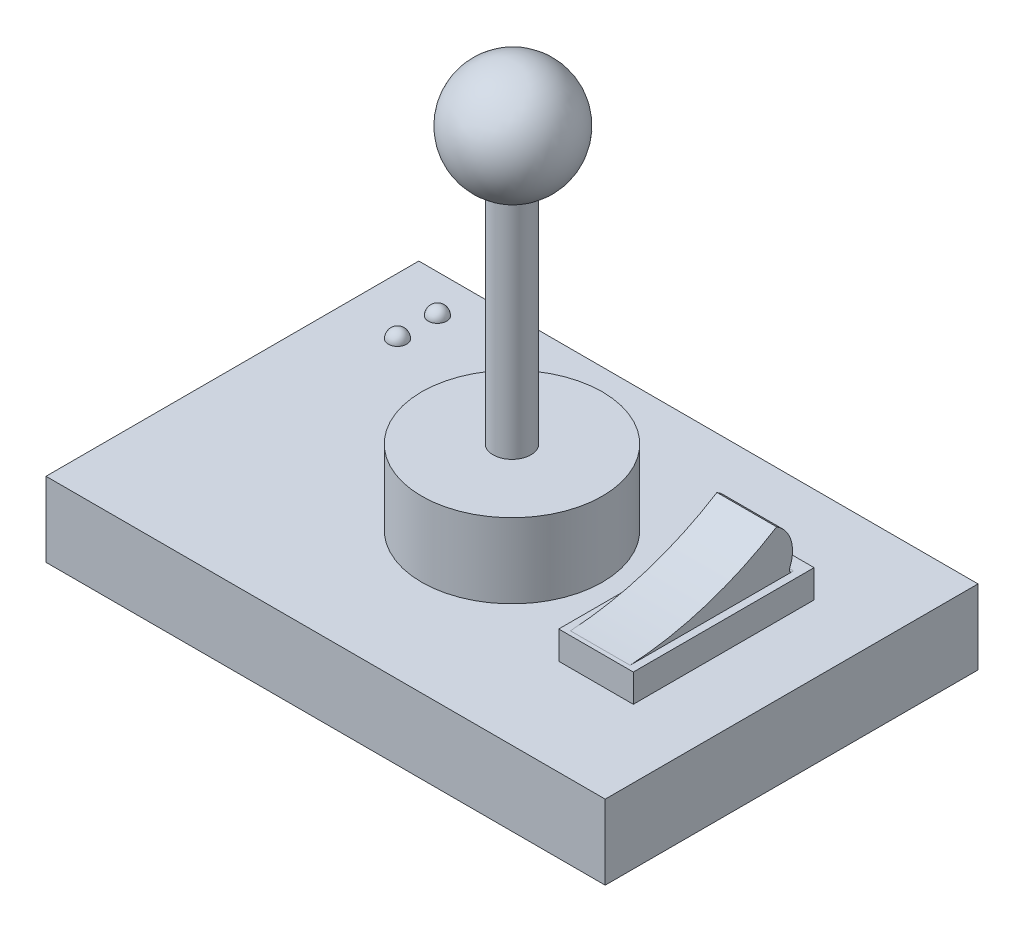
from build123d import *

# Parameters (mm, degrees)
SKETCH1_W            = 150
SKETCH1_H            = 100
BOSS_EXTRUDE1_DEPTH  = 20
SKETCH2_R            = 24.239154651
BOSS_EXTRUDE2_DEPTH  = 40
SKETCH3_R            = 5.073901121
BOSS_EXTRUDE3_DEPTH  = 100
SKETCH17_W           = 20
SKETCH17_H           = 48.5
BOSS_EXTRUDE14_DEPTH = 7.5
BOSS_EXTRUDE15_START = -2
BOSS_EXTRUDE15_DEPTH = 16
FILLET5_START        = 38.747344483
FILLET5_DEPTH        = 16


with BuildPart() as part:
    # Sketch1 → Boss-Extrude1 (new body)
    with BuildSketch(Plane(origin=(0, 0, 0), x_dir=(1, 0, 0), z_dir=(0, 1, 0))):
        Rectangle(SKETCH1_W, SKETCH1_H)
    extrude(amount=BOSS_EXTRUDE1_DEPTH)

    # Sketch2 → Boss-Extrude2 (add)
    with BuildSketch(Plane(origin=(0, 0, 0), x_dir=(1, 0, 0), z_dir=(0, 1, 0))):
        with Locations(Location((0, 0, 0), (0, 0, 270))):
            Circle(SKETCH2_R)
    extrude(amount=BOSS_EXTRUDE2_DEPTH)

    # Sketch3 → Boss-Extrude3 (add)
    with BuildSketch(Plane(origin=(0, 0, 0), x_dir=(1, 0, 0), z_dir=(0, 1, 0))):
        with Locations(Location((0, 0, 0), (0, 0, 90))):
            Circle(SKETCH3_R)
    extrude(amount=BOSS_EXTRUDE3_DEPTH)

    # Sketch5 → Revolve2 (revolve)
    with BuildSketch(Plane(origin=(0, 0, 0), x_dir=(0, 0, -1), z_dir=(1, 0, 0))):
        with BuildLine():
            Line((0.229753848, 98.790742156), (0.229753848, 128.790742156))
            ThreePointArc((0.229753848, 128.790742156), (-14.770246152, 113.790742156), (0.229753848, 98.790742156))
        make_face()
    revolve(axis=Axis((0, 98.790742156, -0.229753848), (0, 1, 0)))

    # Sketch17 → Boss-Extrude14 (add)
    with BuildSketch(Plane(origin=(0, 20, 0), x_dir=(1, 0, 0), z_dir=(0, 1, 0))):
        with Locations((46.747344483, 0.04322355)):
            Rectangle(SKETCH17_W, SKETCH17_H)
    extrude(amount=BOSS_EXTRUDE14_DEPTH)

    # Sketch21 → Boss-Extrude15 (add)
    with BuildSketch(Plane(origin=(56.747344483, 0, 0), x_dir=(0, 0, -1), z_dir=(1, 0, 0)).offset(BOSS_EXTRUDE15_START)):
        with BuildLine():
            Line((19.134328626, 27.5), (-23.063699683, 27.5))
            ThreePointArc((-23.063699683, 27.5), (-2.634761018, 31.291523365), (16.230010888, 40))
            ThreePointArc((16.230010888, 40), (20.271004522, 34.351503898), (19.134328626, 27.5))
        make_face()
    extrude(amount=-BOSS_EXTRUDE15_DEPTH)

    # Fillet5: read off the stored shape, not the designer's step
    # Fillet5 outline → Fillet5 (add)
    with BuildSketch(Plane.YZ.offset(FILLET5_START)):
        with BuildLine():
            Line((27.5, -19.134328626), (27.5, -20.763165982))
            add(Edge.make_bspline(
                [(27.5, -20.763165982), (27.5, -20.531845888), (27.5, -20.300525794), (27.623544112, -19.810870378), (27.937534857, -19.585621938), (28.467988806, -19.663458549), (28.675738966, -19.755036772), (28.876983932, -19.836946184)],
                knots=[0, 0, 0, 0, 0, 0, 0.5, 0.5, 1, 1, 1, 1, 1, 1], degree=5))
            ThreePointArc((28.876983932, -19.836946184), (28.173502588, -19.515013461), (27.5, -19.134328626))
        make_face()
    extrude(amount=FILLET5_DEPTH)

    # Sketch24 → Revolve3 (revolve)
    with BuildSketch(Plane(origin=(0, 20, 0), x_dir=(1, 0, 0), z_dir=(0, 1, 0))):
        with BuildLine():
            Line((-62.255471135, 39.768833527), (-57.287341541, 39.768833527))
            ThreePointArc((-57.287341541, 39.768833527), (-59.771406338, 42.252898324), (-62.255471135, 39.768833527))
        make_face()
    revolve(axis=Axis((-62.255471135, 20, -39.768833527), (1, 0, 0)))

    # Sketch25 → Revolve4 (revolve)
    with BuildSketch(Plane(origin=(0, 20, 0), x_dir=(1, 0, 0), z_dir=(0, 1, 0))):
        with BuildLine():
            Line((-62.255471135, 29.059615512), (-57.287341541, 29.059615512))
            ThreePointArc((-57.287341541, 29.059615512), (-59.771406338, 31.543680309), (-62.255471135, 29.059615512))
        make_face()
    revolve(axis=Axis((-62.255471135, 20, -29.059615512), (1, 0, 0)))


solid = part.part
